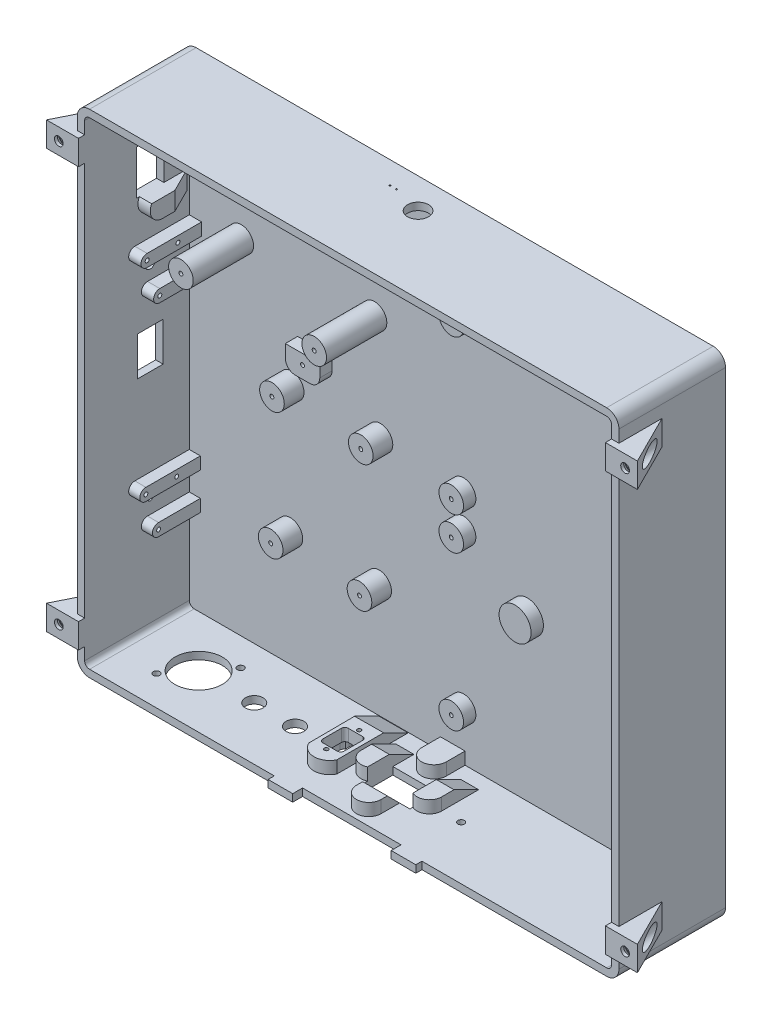
from build123d import *

# Parameters (mm, degrees)
SKETCH2_W                                      = 279.4
SKETCH2_H                                      = 254
BOSS_EXTRUDE1_DEPTH                            = 1
FILLET2_R                                      = 6.35
BOSS_EXTRUDE3_START                            = 57.15
BOSS_EXTRUDE3_DEPTH                            = 57.15
SKETCH7_W                                      = 50.8
SKETCH7_H                                      = 5.08
ROMEX_ENTRY_SLOT_DEPTH                         = 57.15
BOSS_EXTRUDE4_DEPTH                            = 12.7
SKETCH9_R                                      = 3.81
CUT_EXTRUDE2_DEPTH                             = 35.306
MIRROR3_COPY_1_DEPTH                           = 12.7
MIRROR3_COPY_2_SKETCH_R                        = 3.81
MIRROR3_COPY_2_DEPTH                           = 35.306
MIRROR4_COPY_1_DEPTH                           = 12.7
MIRROR4_COPY_2_SKETCH_R                        = 3.81
MIRROR4_COPY_2_DEPTH                           = 35.306
MIRROR4_COPY_4_DEPTH                           = 12.7
MIRROR4_COPY_5_SKETCH_R                        = 3.81
MIRROR4_COPY_5_DEPTH                           = 35.306
MIRROR4_COPY_7_DEPTH                           = 12.7
MIRROR4_COPY_8_SKETCH_R                        = 3.81
MIRROR4_COPY_8_DEPTH                           = 35.306
SKETCH15_W                                     = 12.7
SKETCH15_H                                     = 228.6
CUT_EXTRUDE4_DEPTH                             = 30.226
CUT_EXTRUDE8_REACH                             = 325.779
SKETCH24_R                                     = 2.5019
SKETCH24_R_2                                   = 1.318988248
SKETCH24_W                                     = 13.208
SKETCH24_H                                     = 20.066
SKETCH24_W_2                                   = 14.0462
SKETCH24_H_2                                   = 22.86
CUT_EXTRUDE10_REACH                            = 325.779
SKETCH30_R                                     = 1.27
RIGHT_SIDE_FRONT_STANDOFFS_DEPTH               = 6.35
RIGHT_SIDE_REAR_STANDOFFS_DEPTH                = 5.715
F_3_0_213_DIAMETER_HOLE1_D                     = 2.032
F_3_0_213_DIAMETER_HOLE1_DEPTH                 = 6.35
F_3_0_213_DIAMETER_HOLE1_TIP                   = 0.610474389
F_3_0_213_DIAMETER_HOLE2_D                     = 2.032
F_3_0_213_DIAMETER_HOLE2_DEPTH                 = 6.35
F_3_0_213_DIAMETER_HOLE2_TIP                   = 0.610474389
SKETCH39_R                                     = 8.255
SKETCH39_R_2                                   = 6.35
BOSS_EXTRUDE11_DEPTH                           = 6.35
STANDOFF_HOLES_D                               = 2.032
STANDOFF_HOLES_DEPTH                           = 6.35
STANDOFF_HOLES_TIP                             = 0.610474389
SKETCH49_R                                     = 6.35
MOTHERBOARD_STANDOFFS_DEPTH                    = 10.16
MOTHERBOARD_SCREW_HOLES_D                      = 2.032
MOTHERBOARD_SCREW_HOLES_DEPTH                  = 6.35
MOTHERBOARD_SCREW_HOLES_TIP                    = 0.610474389
BOSS_EXTRUDE13_DEPTH                           = 6.35
SKETCH58_R                                     = 4.572
SKETCH58_R_2                                   = 12.2428
SKETCH58_R_3                                   = 1.7
SKETCH58_R_4                                   = 1.651
CUT_EXTRUDE13_DEPTH                            = 3.81
CUT_EXTRUDE14_REACH                            = 303.866
SKETCH59_R                                     = 5.4356
SKETCH59_R_2                                   = 0.381
SKETCH60_R                                     = 6.35
BOSS_EXTRUDE15_DEPTH                           = 31.115
F_3_0_213_DIAMETER_HOLE6_D                     = 2.032
F_3_0_213_DIAMETER_HOLE6_DEPTH                 = 6.35
F_3_0_213_DIAMETER_HOLE6_TIP                   = 0.610474389
VENT_CUT_DEPTH                                 = 207.727314354
VENT_CUT_DEPTH_BACK                            = 3.175
SKETCH63_W                                     = 3.81
SKETCH63_H                                     = 203.2
USB_CUTOUT_REACH                               = 303.866
USB_STANDOFF_DEPTH                             = 6.35
USB_STANDOFF_SUPPORT_REACH                     = 237.887
SKETCH69_W                                     = 23.368
SKETCH69_H                                     = 14.5542
MOTHERBOARD_POWER_SWITCH_CUTOUT_DEPTH          = 3.81
USB_SCREW_HOLES_D                              = 2.032
USB_SCREW_HOLES_DEPTH                          = 6.35
USB_SCREW_HOLES_TIP                            = 0.610474389
MOTHERBOARD_POWER_SWITCH_STANDOFFS_DEPTH       = 6.35
MOTHERBOARD_POWER_SWITCH_STANDOFF_SUPPOR_DEPTH = 9.09955
MOTHERBOARD_POWER_SWITCH_STANDOFF_SU_2_DEPTH   = 9.09955
REAR_SCREW_HOLES_D                             = 2.794
REAR_SCREW_HOLES_DEPTH                         = 6.35
REAR_SCREW_HOLES_TIP                           = 0.839402285
BOSS_EXTRUDE16_DEPTH                           = 9.35355
BOSS_EXTRUDE17_DEPTH                           = 9.35355
LEFT_SIDE_PSU_SCREW_HOLES_D                    = 2.032
LEFT_SIDE_PSU_SCREW_HOLES_DEPTH                = 6.35
LEFT_SIDE_PSU_SCREW_HOLES_TIP                  = 0.610474389
SLIDE_COVER_STANDOFFS_DEPTH                    = 6.35
F_3_0_213_DIAMETER_HOLE7_D                     = 2.032
F_3_0_213_DIAMETER_HOLE7_DEPTH                 = 6.35
F_3_0_213_DIAMETER_HOLE7_TIP                   = 0.610474389
CUT_EXTRUDE15_DEPTH                            = 12.7


with BuildPart() as part:
    # Sketch2 → Boss-Extrude1 (new body)
    with BuildSketch(Plane.XY):
        Rectangle(SKETCH2_W, SKETCH2_H)
    extrude(amount=BOSS_EXTRUDE1_DEPTH)

    # Fillet2
    fillet2_edges = [part.edges().sort_by_distance(p)[0] for p in [
        (-139.7, 127, 0.5),
        (139.7, 127, 0.5),
        (139.7, -127, 0.5),
        (-139.7, -127, 0.5),
    ]]
    fillet(fillet2_edges, radius=FILLET2_R)

    # Sketch5 → Boss-Extrude3 (add)
    with BuildSketch(Plane.XY.offset(1).offset(BOSS_EXTRUDE3_START)):
        with BuildLine():
            Line((-133.35, -127), (133.35, -127))
            ThreePointArc((133.35, -127), (137.840128061, -125.140128061), (139.7, -120.65))
            Line((139.7, -120.65), (139.7, 120.65))
            ThreePointArc((139.7, 120.65), (137.840128061, 125.140128061), (133.35, 127))
            Line((133.35, 127), (-133.35, 127))
            ThreePointArc((-133.35, 127), (-137.840128061, 125.140128061), (-139.7, 120.65))
            Line((-139.7, 120.65), (-139.7, -120.65))
            ThreePointArc((-139.7, -120.65), (-137.840128061, -125.140128061), (-133.35, -127))
        make_face()
        with BuildLine():
            Line((-133.35, -123.19), (133.35, -123.19))
            ThreePointArc((133.35, -123.19), (135.146051224, -122.446051224), (135.89, -120.65))
            Line((135.89, -120.65), (135.89, 120.65))
            ThreePointArc((135.89, 120.65), (135.146051224, 122.446051224), (133.35, 123.19))
            Line((133.35, 123.19), (-133.35, 123.19))
            ThreePointArc((-133.35, 123.19), (-135.146051224, 122.446051224), (-135.89, 120.65))
            Line((-135.89, 120.65), (-135.89, -120.65))
            ThreePointArc((-135.89, -120.65), (-135.146051224, -122.446051224), (-133.35, -123.19))
        make_face(mode=Mode.SUBTRACT)
    extrude(amount=-BOSS_EXTRUDE3_DEPTH)

    # Sketch7 → Romex Entry Slot (cut)
    with BuildSketch(Plane(origin=(0, -123.19, 0), x_dir=(1, 0, 0), z_dir=(0, 1, 0))):
        with Locations((0, -55.61)):
            Rectangle(SKETCH7_W, SKETCH7_H)
    extrude(amount=-ROMEX_ENTRY_SLOT_DEPTH, mode=Mode.SUBTRACT)

    # Sketch8 → Boss-Extrude4 (add)
    with BuildSketch(Plane(origin=(0, 101.6, 0), x_dir=(1, 0, 0), z_dir=(0, 1, 0))):
        Polygon((-139.7, 0), (-152.4, 0), (-139.7, -25.4), align=None)
    boss_extrude4 = extrude(amount=BOSS_EXTRUDE4_DEPTH)

    # Sketch9 → Cut-Extrude2 (cut)
    with BuildSketch(Plane(origin=(0, 0, 3.81), x_dir=(-1, 0, 0), z_dir=(0, 0, -1))):
        with Locations((146.05, 107.95)):
            Circle(SKETCH9_R)
    cut_extrude2 = extrude(amount=-CUT_EXTRUDE2_DEPTH, mode=Mode.SUBTRACT)

    # Sketch13 → CSK for #8 Flat Head Machine Screw1 (revolve, cut)
    with BuildSketch(Plane(origin=(-146.05, 107.95, 3.81), x_dir=(0, -1, 0), z_dir=(1, 0, 0))):
        Polygon((0, 0), (0, 3.81), (2.2479, 3.81), (2.2479, 2.26450021), (4.2164, 0), align=None)
    csk_for_8_flat_head_machine_screw1 = revolve(axis=Axis((-146.05, 107.95, 10.16), (0, 0, -1)), mode=Mode.SUBTRACT)

    # Mirror2: Boss-Extrude4, Cut-Extrude2, CSK for #8 Flat Head Machine Screw1 across plane
    add(boss_extrude4.mirror(Plane.ZX))
    add(cut_extrude2.mirror(Plane.ZX), mode=Mode.SUBTRACT)
    add(csk_for_8_flat_head_machine_screw1.mirror(Plane.ZX), mode=Mode.SUBTRACT)

    # Mirror3: Boss-Extrude4, Cut-Extrude2, CSK for #8 Flat Head Machine Screw1 across plane
    add(boss_extrude4.mirror(Plane.ZY))
    add(cut_extrude2.mirror(Plane.ZY), mode=Mode.SUBTRACT)
    add(csk_for_8_flat_head_machine_screw1.mirror(Plane.ZY), mode=Mode.SUBTRACT)

    # Mirror3 copy 1 sketch → Mirror3 copy 1 (add)
    with BuildSketch(Plane(origin=(0, -101.6, 0), x_dir=(-1, 0, 0), z_dir=(0, -1, 0))):
        Polygon((-139.7, 0), (-152.4, 0), (-139.7, -25.4), align=None)
    extrude(amount=MIRROR3_COPY_1_DEPTH)

    # Mirror3 copy 2 sketch → Mirror3 copy 2 (cut)
    with BuildSketch(Plane(origin=(0, 0, 3.81), x_dir=(1, 0, 0), z_dir=(0, 0, -1))):
        with Locations((146.05, 107.95)):
            Circle(MIRROR3_COPY_2_SKETCH_R)
    extrude(amount=-MIRROR3_COPY_2_DEPTH, mode=Mode.SUBTRACT)

    # Mirror3 copy 3 sketch → Mirror3 copy 3 (revolve, cut)
    with BuildSketch(Plane(origin=(146.05, -107.95, 3.81), x_dir=(0, 1, 0), z_dir=(-1, 0, 0))):
        Polygon((0, 0), (0, 3.81), (2.2479, 3.81), (2.2479, 2.26450021), (4.2164, 0), align=None)
    revolve(axis=Axis((146.05, -107.95, 10.16), (0, 0, -1)), mode=Mode.SUBTRACT)

    # Mirror4: Boss-Extrude4, Cut-Extrude2, CSK for #8 Flat Head Machine Screw1 across plane
    add(boss_extrude4.mirror(Plane(origin=(0, 0, 29.075), x_dir=(1, 0, 0), z_dir=(0, 0, -1))))
    add(cut_extrude2.mirror(Plane(origin=(0, 0, 29.075), x_dir=(1, 0, 0), z_dir=(0, 0, -1))), mode=Mode.SUBTRACT)
    add(csk_for_8_flat_head_machine_screw1.mirror(Plane(origin=(0, 0, 29.075), x_dir=(1, 0, 0), z_dir=(0, 0, -1))), mode=Mode.SUBTRACT)

    # Mirror4 copy 1 sketch → Mirror4 copy 1 (add)
    with BuildSketch(Plane(origin=(0, -101.6, 58.15), x_dir=(1, 0, 0), z_dir=(0, -1, 0))):
        Polygon((-139.7, 0), (-152.4, 0), (-139.7, -25.4), align=None)
    extrude(amount=MIRROR4_COPY_1_DEPTH)

    # Mirror4 copy 2 sketch → Mirror4 copy 2 (cut)
    with BuildSketch(Plane(origin=(0, 0, 54.34), x_dir=(-1, 0, 0), z_dir=(0, 0, 1))):
        with Locations((146.05, 107.95)):
            Circle(MIRROR4_COPY_2_SKETCH_R)
    extrude(amount=-MIRROR4_COPY_2_DEPTH, mode=Mode.SUBTRACT)

    # Mirror4 copy 3 sketch → Mirror4 copy 3 (revolve, cut)
    with BuildSketch(Plane(origin=(-146.05, -107.95, 54.34), x_dir=(0, 1, 0), z_dir=(1, 0, 0))):
        Polygon((0, 0), (0, 3.81), (2.2479, 3.81), (2.2479, 2.26450021), (4.2164, 0), align=None)
    revolve(axis=Axis((-146.05, -107.95, 47.99), (0, 0, 1)), mode=Mode.SUBTRACT)

    # Mirror4 copy 4 sketch → Mirror4 copy 4 (add)
    with BuildSketch(Plane(origin=(0, 101.6, 58.15), x_dir=(-1, 0, 0), z_dir=(0, 1, 0))):
        Polygon((-139.7, 0), (-152.4, 0), (-139.7, -25.4), align=None)
    extrude(amount=MIRROR4_COPY_4_DEPTH)

    # Mirror4 copy 5 sketch → Mirror4 copy 5 (cut)
    with BuildSketch(Plane.XY.offset(54.34)):
        with Locations((146.05, 107.95)):
            Circle(MIRROR4_COPY_5_SKETCH_R)
    extrude(amount=-MIRROR4_COPY_5_DEPTH, mode=Mode.SUBTRACT)

    # Mirror4 copy 6 sketch → Mirror4 copy 6 (revolve, cut)
    with BuildSketch(Plane(origin=(146.05, 107.95, 54.34), x_dir=(0, -1, 0), z_dir=(-1, 0, 0))):
        Polygon((0, 0), (0, 3.81), (2.2479, 3.81), (2.2479, 2.26450021), (4.2164, 0), align=None)
    revolve(axis=Axis((146.05, 107.95, 47.99), (0, 0, 1)), mode=Mode.SUBTRACT)

    # Mirror4 copy 7 sketch → Mirror4 copy 7 (add)
    with BuildSketch(Plane(origin=(0, -101.6, 58.15), x_dir=(-1, 0, 0), z_dir=(0, -1, 0))):
        Polygon((-139.7, 0), (-152.4, 0), (-139.7, 25.4), align=None)
    extrude(amount=MIRROR4_COPY_7_DEPTH)

    # Mirror4 copy 8 sketch → Mirror4 copy 8 (cut)
    with BuildSketch(Plane.XY.offset(54.34)):
        with Locations((146.05, -107.95)):
            Circle(MIRROR4_COPY_8_SKETCH_R)
    extrude(amount=-MIRROR4_COPY_8_DEPTH, mode=Mode.SUBTRACT)

    # Mirror4 copy 9 sketch → Mirror4 copy 9 (revolve, cut)
    with BuildSketch(Plane(origin=(146.05, -107.95, 54.34), x_dir=(0, 1, 0), z_dir=(-1, 0, 0))):
        Polygon((0, 0), (0, -3.81), (2.2479, -3.81), (2.2479, -2.26450021), (4.2164, 0), align=None)
    revolve(axis=Axis((146.05, -107.95, 47.99), (0, 0, -1)), mode=Mode.SUBTRACT)

    # Sketch15 → Cut-Extrude4 (cut)
    with BuildSketch(Plane(origin=(0, 0, 0), x_dir=(-1, 0, 0), z_dir=(0, 0, -1))):
        with Locations((-146.05, 0)):
            Rectangle(SKETCH15_W, SKETCH15_H)
        with Locations((146.05, 0)):
            Rectangle(SKETCH15_W, SKETCH15_H)
    extrude(amount=-CUT_EXTRUDE4_DEPTH, mode=Mode.SUBTRACT)

    # Sketch24 → Cut-Extrude8 (cut, up to next)
    with BuildSketch(Plane.ZY.offset(139.7), mode=Mode.PRIVATE) as cut_extrude8_sk1:
        with Locations((21.1375, 39.941265276)):
            Circle(SKETCH24_R)
    cut_extrude8_tool1 = extrude(cut_extrude8_sk1.sketch, amount=-CUT_EXTRUDE8_REACH, mode=Mode.PRIVATE) & part.part
    # Sketch24 → Cut-Extrude8 (cut, up to next)
    with BuildSketch(Plane.ZY.offset(139.7), mode=Mode.PRIVATE) as cut_extrude8_sk2:
        with Locations((21.1375, 98.41033486)):
            Circle(SKETCH24_R_2)
    cut_extrude8_tool2 = extrude(cut_extrude8_sk2.sketch, amount=-CUT_EXTRUDE8_REACH, mode=Mode.PRIVATE) & part.part
    # Sketch24 → Cut-Extrude8 (cut, up to next)
    with BuildSketch(Plane.ZY.offset(139.7), mode=Mode.PRIVATE) as cut_extrude8_sk3:
        with Locations((21.1375, 69.54323486)):
            Circle(SKETCH24_R_2)
    cut_extrude8_tool3 = extrude(cut_extrude8_sk3.sketch, amount=-CUT_EXTRUDE8_REACH, mode=Mode.PRIVATE) & part.part
    # Sketch24 → Cut-Extrude8 (cut, up to next)
    with BuildSketch(Plane.ZY.offset(139.7), mode=Mode.PRIVATE) as cut_extrude8_sk4:
        with Locations((21.1375, 1.653505964)):
            Rectangle(SKETCH24_W, SKETCH24_H)
    cut_extrude8_tool4 = extrude(cut_extrude8_sk4.sketch, amount=-CUT_EXTRUDE8_REACH, mode=Mode.PRIVATE) & part.part
    # Sketch24 → Cut-Extrude8 (cut, up to next)
    with BuildSketch(Plane.ZY.offset(139.7), mode=Mode.PRIVATE) as cut_extrude8_sk5:
        with Locations((21.1375, 83.97678486)):
            Rectangle(SKETCH24_W_2, SKETCH24_H_2)
    cut_extrude8_tool5 = extrude(cut_extrude8_sk5.sketch, amount=-CUT_EXTRUDE8_REACH, mode=Mode.PRIVATE) & part.part
    add(cut_extrude8_tool1.solids().sort_by_distance((-139.7, 39.941265, 21.1375))[0], mode=Mode.SUBTRACT)
    add(cut_extrude8_tool2.solids().sort_by_distance((-139.7, 98.410335, 21.1375))[0], mode=Mode.SUBTRACT)
    add(cut_extrude8_tool3.solids().sort_by_distance((-139.7, 69.543235, 21.1375))[0], mode=Mode.SUBTRACT)
    add(cut_extrude8_tool4.solids().sort_by_distance((-139.7, 1.653506, 21.1375))[0], mode=Mode.SUBTRACT)
    add(cut_extrude8_tool5.solids().sort_by_distance((-139.7, 83.976785, 21.1375))[0], mode=Mode.SUBTRACT)

    # Sketch30 → Cut-Extrude10 (cut, up to next)
    with BuildSketch(Plane.ZY.offset(139.7), mode=Mode.PRIVATE) as cut_extrude10_sk1:
        with Locations((21.1375, -64.878547454)):
            Circle(SKETCH30_R)
    cut_extrude10_tool1 = extrude(cut_extrude10_sk1.sketch, amount=-CUT_EXTRUDE10_REACH, mode=Mode.PRIVATE) & part.part
    add(cut_extrude10_tool1.solids().sort_by_distance((-139.7, -64.878547, 21.1375))[0], mode=Mode.SUBTRACT)

    # Sketch27 → Right Side Front Standoffs (add)
    with BuildSketch(Plane(origin=(-135.89, 0, 0), x_dir=(0, 0, -1), z_dir=(1, 0, 0))):
        with BuildLine():
            Line((-29.0864608, 51.565215276), (-1, 51.565215276))
            Line((-1, 51.565215276), (-1, 45.215215276))
            Line((-1, 45.215215276), (-29.0864608, 45.215215276))
            ThreePointArc((-29.0864608, 45.215215276), (-32.2614608, 48.390215276), (-29.0864608, 51.565215276))
        make_face()
        with BuildLine():
            Line((-22.5523108, 32.585065276), (-1, 32.585065276))
            Line((-1, 32.585065276), (-1, 26.235065276))
            Line((-1, 26.235065276), (-22.5523108, 26.235065276))
            ThreePointArc((-22.5523108, 26.235065276), (-25.7273108, 29.410065276), (-22.5523108, 32.585065276))
        make_face()
        with BuildLine():
            Line((-14.7875, 104.76033486), (-14.7875, 95.40678486))
            Line((-14.7875, 95.40678486), (-26.73224641, 95.40678486))
            ThreePointArc((-26.73224641, 95.40678486), (-26.587043215, 101.669932803), (-21.1375, 104.76033486))
            Line((-21.1375, 104.76033486), (-14.7875, 104.76033486))
        make_face()
        with BuildLine():
            Line((-21.1375, 63.19323486), (-14.7875, 63.19323486))
            Line((-14.7875, 63.19323486), (-14.7875, 72.54678486))
            Line((-14.7875, 72.54678486), (-26.73224641, 72.54678486))
            ThreePointArc((-26.73224641, 72.54678486), (-26.587043215, 66.283636917), (-21.1375, 63.19323486))
        make_face()
    extrude(amount=RIGHT_SIDE_FRONT_STANDOFFS_DEPTH)

    # Sketch28 → Right Side Rear Standoffs (add)
    with BuildSketch(Plane(origin=(-135.89, 0, 0), x_dir=(0, 0, -1), z_dir=(1, 0, 0))):
        with BuildLine():
            Line((-29.0864608, -53.254597454), (-1, -53.254597454))
            Line((-1, -53.254597454), (-1, -59.604597454))
            Line((-1, -59.604597454), (-29.0864608, -59.604597454))
            ThreePointArc((-29.0864608, -59.604597454), (-32.2614608, -56.429597454), (-29.0864608, -53.254597454))
        make_face()
        with BuildLine():
            Line((-22.5523108, -72.234747454), (-1, -72.234747454))
            Line((-1, -72.234747454), (-1, -78.584747454))
            Line((-1, -78.584747454), (-22.5523108, -78.584747454))
            ThreePointArc((-22.5523108, -78.584747454), (-25.7273108, -75.409747454), (-22.5523108, -72.234747454))
        make_face()
    extrude(amount=RIGHT_SIDE_REAR_STANDOFFS_DEPTH)

    # #3 (0.213) Diameter Hole1
    with Locations(Plane(origin=(-129.54, 0, 0), x_dir=(0, 0, -1), z_dir=(1, 0, 0))):
        with Locations((-29.0864608, 48.390215276), (-13.18855, 48.390215276), (-22.5523108, 29.410065276)):
            Hole(F_3_0_213_DIAMETER_HOLE1_D / 2, depth=F_3_0_213_DIAMETER_HOLE1_DEPTH)
            with Locations((0, 0, -(F_3_0_213_DIAMETER_HOLE1_DEPTH + F_3_0_213_DIAMETER_HOLE1_TIP / 2))):  # 118° drill point
                Cone(0, F_3_0_213_DIAMETER_HOLE1_D / 2, F_3_0_213_DIAMETER_HOLE1_TIP, mode=Mode.SUBTRACT)

    # #3 (0.213) Diameter Hole2
    with Locations(Plane(origin=(-130.175, 0, 0), x_dir=(0, 0, -1), z_dir=(1, 0, 0))):
        with Locations((-29.0864608, -56.429597454), (-13.18855, -56.429597454), (-22.5523108, -75.409747454)):
            Hole(F_3_0_213_DIAMETER_HOLE2_D / 2, depth=F_3_0_213_DIAMETER_HOLE2_DEPTH)
            with Locations((0, 0, -(F_3_0_213_DIAMETER_HOLE2_DEPTH + F_3_0_213_DIAMETER_HOLE2_TIP / 2))):  # 118° drill point
                Cone(0, F_3_0_213_DIAMETER_HOLE2_D / 2, F_3_0_213_DIAMETER_HOLE2_TIP, mode=Mode.SUBTRACT)

    # Sketch39 → Boss-Extrude11 (add)
    with BuildSketch(Plane.XY.offset(1)):
        with Locations(Location((123.698, -40.639456059, 0), (0, 0, 180))):
            Circle(SKETCH39_R)
        with Locations(Location((38.5191, 112.116669853, 0), (0, 0, 180))):
            Circle(SKETCH39_R)
        with Locations(Location((5.583485881, -98.020620855, 0), (0, 0, 180))):
            Circle(SKETCH39_R_2)
        with Locations(Location((5.583485881, -18.645620855, 0), (0, 0, 180))):
            Circle(SKETCH39_R_2)
        with Locations(Location((5.583485881, -1.500620855, 0), (0, 0, 180))):
            Circle(SKETCH39_R_2)
        with Locations(Location((5.583485881, 77.874379145, 0), (0, 0, 180))):
            Circle(SKETCH39_R_2)
        with Locations(Location((38.5191, -40.639456059, 0), (0, 0, 180))):
            Circle(SKETCH39_R)
        with Locations(Location((123.698, 112.116669853, 0), (0, 0, 180))):
            Circle(SKETCH39_R)
        with BuildLine():
            Line((-80.013490438, 105.820173199), (-62.233490438, 105.820173199))
            Line((-62.233490438, 105.820173199), (-62.233490438, 114.418436715))
            ThreePointArc((-62.233490438, 114.418436715), (-63.72138799, 118.010539163), (-67.313490438, 119.498436715))
            Line((-67.313490438, 119.498436715), (-74.933490438, 119.498436715))
            ThreePointArc((-74.933490438, 119.498436715), (-78.525592887, 118.010539163), (-80.013490438, 114.418436715))
            Line((-80.013490438, 114.418436715), (-80.013490438, 105.820173199))
        make_face()
        with BuildLine():
            Line((-62.233490438, 25.175173199), (-80.013490438, 25.175173199))
            Line((-80.013490438, 25.175173199), (-80.013490438, 18.722402026))
            ThreePointArc((-80.013490438, 18.722402026), (-78.525592887, 15.130299577), (-74.933490438, 13.642402026))
            Line((-74.933490438, 13.642402026), (-67.313490438, 13.642402026))
            ThreePointArc((-67.313490438, 13.642402026), (-63.72138799, 15.130299577), (-62.233490438, 18.722402026))
            Line((-62.233490438, 18.722402026), (-62.233490438, 25.175173199))
        make_face()
    extrude(amount=BOSS_EXTRUDE11_DEPTH)

    # Standoff Holes
    with Locations(Plane.XY.offset(7.35)):
        with Locations((-71.123490438, 20.050115749), (-71.123490438, 113.090722992), (5.583485881, -98.020620855), (5.583485881, -18.645620855), (5.583485881, -1.500620855), (5.583485881, 77.874379145), (123.698, -40.639456059), (38.5191, 112.116669853)):
            Hole(STANDOFF_HOLES_D / 2, depth=STANDOFF_HOLES_DEPTH)
            with Locations((0, 0, -(STANDOFF_HOLES_DEPTH + STANDOFF_HOLES_TIP / 2))):  # 118° drill point
                Cone(0, STANDOFF_HOLES_D / 2, STANDOFF_HOLES_TIP, mode=Mode.SUBTRACT)

    # Sketch49 → Motherboard Standoffs (add)
    with BuildSketch(Plane.XY.offset(1)):
        with Locations(Location((-83.086839482, 1.79886482, 0), (0, 0, 180))):
            Circle(SKETCH49_R)
        with Locations(Location((-37.280139973, 1.339777633, 0), (0, 0, 180))):
            Circle(SKETCH49_R)
        with Locations(Location((-37.939662527, -64.465917493, 0), (0, 0, 180))):
            Circle(SKETCH49_R)
        with Locations(Location((-83.746362036, -64.006830306, 0), (0, 0, 180))):
            Circle(SKETCH49_R)
    extrude(amount=MOTHERBOARD_STANDOFFS_DEPTH)

    # Motherboard Screw Holes
    with Locations(Plane.XY.offset(11.16)):
        with Locations((-83.086839482, 1.79886482), (-37.280139973, 1.339777633), (-37.939662527, -64.465917493), (-83.746362036, -64.006830306)):
            Hole(MOTHERBOARD_SCREW_HOLES_D / 2, depth=MOTHERBOARD_SCREW_HOLES_DEPTH)
            with Locations((0, 0, -(MOTHERBOARD_SCREW_HOLES_DEPTH + MOTHERBOARD_SCREW_HOLES_TIP / 2))):  # 118° drill point
                Cone(0, MOTHERBOARD_SCREW_HOLES_D / 2, MOTHERBOARD_SCREW_HOLES_TIP, mode=Mode.SUBTRACT)

    # Sketch55 → Boss-Extrude13 (add)
    with BuildSketch(Plane.ZY.offset(-135.89)):
        with BuildLine():
            Line((36.66905, 118.947100483), (1, 118.947100483))
            Line((1, 118.947100483), (1, 106.247100483))
            Line((1, 106.247100483), (36.66905, 106.247100483))
            ThreePointArc((36.66905, 106.247100483), (43.01905, 112.597100483), (36.66905, 118.947100483))
        make_face()
        with BuildLine():
            Line((35.3165, -30.112799517), (1, -30.112799517))
            Line((1, -30.112799517), (1, -42.812799517))
            Line((1, -42.812799517), (35.3165, -42.812799517))
            ThreePointArc((35.3165, -42.812799517), (41.6665, -36.462799517), (35.3165, -30.112799517))
        make_face()
    extrude(amount=BOSS_EXTRUDE13_DEPTH)

    # Sketch58 → Cut-Extrude13 (cut)
    with BuildSketch(Plane.XZ.offset(127)):
        with Locations((-54.883181914, 27.4875)):
            Circle(SKETCH58_R)
        with Locations((-75.898929205, 27.4875)):
            Circle(SKETCH58_R)
        with Locations((-104.593225877, 27.4875)):
            Circle(SKETCH58_R_2)
        with Locations((-95.017425877, 15.3971)):
            Circle(SKETCH58_R_3)
        with Locations((-114.169025877, 39.5779)):
            Circle(SKETCH58_R_3)
        with Locations((127.606509889, 27.4875)):
            Circle(SKETCH58_R_4)
        with Locations((30.807109889, 27.4875)):
            Circle(SKETCH58_R_4)
    extrude(amount=-CUT_EXTRUDE13_DEPTH, mode=Mode.SUBTRACT)

    # Sketch59 → Cut-Extrude14 (cut, up to next)
    with BuildSketch(Plane(origin=(0, 127, 0), x_dir=(1, 0, 0), z_dir=(0, 1, 0)), mode=Mode.PRIVATE) as cut_extrude14_sk1:
        with Locations(Location((-3.291977324, -15.605, 0), (0, 0, 180))):
            Circle(SKETCH59_R)
    cut_extrude14_tool1 = extrude(cut_extrude14_sk1.sketch, amount=-CUT_EXTRUDE14_REACH, mode=Mode.PRIVATE) & part.part
    # Sketch59 → Cut-Extrude14 (cut, up to next)
    with BuildSketch(Plane(origin=(0, 127, 0), x_dir=(1, 0, 0), z_dir=(0, 1, 0)), mode=Mode.PRIVATE) as cut_extrude14_sk2:
        with Locations(Location((-21.773536951, -11.580675337, 0), (0, 0, 180))):
            Circle(SKETCH59_R_2)
    cut_extrude14_tool2 = extrude(cut_extrude14_sk2.sketch, amount=-CUT_EXTRUDE14_REACH, mode=Mode.PRIVATE) & part.part
    # Sketch59 → Cut-Extrude14 (cut, up to next)
    with BuildSketch(Plane(origin=(0, 127, 0), x_dir=(1, 0, 0), z_dir=(0, 1, 0)), mode=Mode.PRIVATE) as cut_extrude14_sk3:
        with Locations(Location((-18.471536951, -11.580675337, 0), (0, 0, 180))):
            Circle(SKETCH59_R_2)
    cut_extrude14_tool3 = extrude(cut_extrude14_sk3.sketch, amount=-CUT_EXTRUDE14_REACH, mode=Mode.PRIVATE) & part.part
    add(cut_extrude14_tool1.solids().sort_by_distance((-3.291977, 127, 15.605))[0], mode=Mode.SUBTRACT)
    add(cut_extrude14_tool2.solids().sort_by_distance((-21.773537, 127, 11.580675))[0], mode=Mode.SUBTRACT)
    add(cut_extrude14_tool3.solids().sort_by_distance((-18.471537, 127, 11.580675))[0], mode=Mode.SUBTRACT)

    # Sketch60 → Boss-Extrude15 (add)
    with BuildSketch(Plane.XY.offset(1)):
        with Locations(Location((-40.347044139, 54.24468354, 0), (0, 0, 180))):
            Circle(SKETCH60_R)
        with Locations(Location((-109.092144139, 54.24468354, 0), (0, 0, 180))):
            Circle(SKETCH60_R)
    extrude(amount=BOSS_EXTRUDE15_DEPTH)

    # #3 (0.213) Diameter Hole6
    with Locations(Plane.XY.offset(32.115)):
        with Locations((-40.347044139, 54.24468354), (-109.092144139, 54.24468354)):
            Hole(F_3_0_213_DIAMETER_HOLE6_D / 2, depth=F_3_0_213_DIAMETER_HOLE6_DEPTH)
            with Locations((0, 0, -(F_3_0_213_DIAMETER_HOLE6_DEPTH + F_3_0_213_DIAMETER_HOLE6_TIP / 2))):  # 118° drill point
                Cone(0, F_3_0_213_DIAMETER_HOLE6_D / 2, F_3_0_213_DIAMETER_HOLE6_TIP, mode=Mode.SUBTRACT)

    # Sketch63 → Vent Cut (cut, two sides: drawn at the far end of the back side and taken through both)
    with BuildSketch(Plane.XY.offset(58.15).offset(-VENT_CUT_DEPTH_BACK)):
        with BuildLine():
            ThreePointArc((133.35, -127), (137.840128061, -125.140128061), (139.7, -120.65))
            Line((139.7, -120.65), (139.7, -114.3))
            Line((139.7, -114.3), (135.89, -114.3))
            Line((135.89, -114.3), (135.89, -120.65))
            ThreePointArc((135.89, -120.65), (135.146051224, -122.446051224), (133.35, -123.19))
            Line((133.35, -123.19), (38.1, -123.19))
            Line((38.1, -123.19), (38.1, -127))
            Line((38.1, -127), (133.35, -127))
        make_face()
        with Locations((137.795, 0)):
            Rectangle(SKETCH63_W, SKETCH63_H)
        with BuildLine():
            Line((135.89, 120.65), (135.89, 114.3))
            Line((135.89, 114.3), (139.7, 114.3))
            Line((139.7, 114.3), (139.7, 120.65))
            ThreePointArc((139.7, 120.65), (137.840128061, 125.140128061), (133.35, 127))
            Line((133.35, 127), (-133.35, 127))
            ThreePointArc((-133.35, 127), (-137.840128061, 125.140128061), (-139.7, 120.65))
            Line((-139.7, 120.65), (-139.7, 114.3))
            Line((-139.7, 114.3), (-135.89, 114.3))
            Line((-135.89, 114.3), (-135.89, 120.65))
            ThreePointArc((-135.89, 120.65), (-135.146051224, 122.446051224), (-133.35, 123.19))
            Line((-133.35, 123.19), (133.35, 123.19))
            ThreePointArc((133.35, 123.19), (135.146051224, 122.446051224), (135.89, 120.65))
        make_face()
        with Locations((-137.795, 0)):
            Rectangle(SKETCH63_W, SKETCH63_H)
        with BuildLine():
            Line((-135.89, -120.65), (-135.89, -114.3))
            Line((-135.89, -114.3), (-139.7, -114.3))
            Line((-139.7, -114.3), (-139.7, -120.65))
            ThreePointArc((-139.7, -120.65), (-137.840128061, -125.140128061), (-133.35, -127))
            Line((-133.35, -127), (-38.1, -127))
            Line((-38.1, -127), (-38.1, -123.19))
            Line((-38.1, -123.19), (-133.35, -123.19))
            ThreePointArc((-133.35, -123.19), (-135.146051224, -122.446051224), (-135.89, -120.65))
        make_face()
    extrude(amount=VENT_CUT_DEPTH + VENT_CUT_DEPTH_BACK, mode=Mode.SUBTRACT)

    # Sketch64 → USB Cutout (cut, up to next)
    with BuildSketch(Plane.XZ.offset(127), mode=Mode.PRIVATE) as usb_cutout_sk1:
        with BuildLine():
            Line((-35.546238772, 35.95205), (-35.546238772, 34.217383312))
            ThreePointArc((-35.546238772, 34.217383312), (-36.234491269, 33.338798191), (-36.479688772, 32.25))
            Line((-36.479688772, 32.25), (-36.479688772, 22.725))
            ThreePointArc((-36.479688772, 22.725), (-36.234491269, 21.636201809), (-35.546238772, 20.757616688))
            Line((-35.546238772, 20.757616688), (-35.546238772, 19.02295))
            ThreePointArc((-35.546238772, 19.02295), (-30.263038772, 13.73975), (-24.979838772, 19.02295))
            Line((-24.979838772, 19.02295), (-24.979838772, 20.757616688))
            ThreePointArc((-24.979838772, 20.757616688), (-24.291586276, 21.636201809), (-24.046388772, 22.725))
            Line((-24.046388772, 22.725), (-24.046388772, 32.25))
            ThreePointArc((-24.046388772, 32.25), (-24.291586276, 33.338798191), (-24.979838772, 34.217383312))
            Line((-24.979838772, 34.217383312), (-24.979838772, 35.95205))
            ThreePointArc((-24.979838772, 35.95205), (-30.263038772, 41.23525), (-35.546238772, 35.95205))
        make_face()
    usb_cutout_tool1 = extrude(usb_cutout_sk1.sketch, amount=-USB_CUTOUT_REACH, mode=Mode.PRIVATE) & part.part
    add(usb_cutout_tool1.solids().sort_by_distance((-30.263039, -127, 27.4875))[0], mode=Mode.SUBTRACT)

    # Sketch68 → USB Standoff (add)
    with BuildSketch(Plane(origin=(0, -123.19, 0), x_dir=(1, 0, 0), z_dir=(0, 1, 0))):
        with BuildLine():
            Line((-22.776388772, -1.254), (-22.776388772, -37.992104132))
            ThreePointArc((-22.776388772, -37.992104132), (-30.263038772, -42.50525), (-37.526024643, -37.640329641))
            Line((-37.526024643, -37.640329641), (-37.749688772, -1.254))
            Line((-37.749688772, -1.254), (-22.776388772, -1.254))
        make_face()
        with BuildLine():
            Line((-35.717688772, -22.725), (-35.717688772, -32.25))
            ThreePointArc((-35.717688772, -32.25), (-35.196924629, -33.507235857), (-33.939688772, -34.028))
            Line((-33.939688772, -34.028), (-26.586388772, -34.028))
            ThreePointArc((-26.586388772, -34.028), (-25.329152916, -33.507235857), (-24.808388772, -32.25))
            Line((-24.808388772, -32.25), (-24.808388772, -22.725))
            ThreePointArc((-24.808388772, -22.725), (-25.329152916, -21.467764143), (-26.586388772, -20.947))
            Line((-26.586388772, -20.947), (-33.939688772, -20.947))
            ThreePointArc((-33.939688772, -20.947), (-35.196924629, -21.467764143), (-35.717688772, -22.725))
        make_face(mode=Mode.SUBTRACT)
    extrude(amount=USB_STANDOFF_DEPTH)

    # USB Standoff support: up to this plane
    usb_standoff_support_end = Plane(origin=(-22.776388772, -116.84, 1.254), z_dir=(-1, 0, 0))
    # Sketch98 → USB Standoff support (cut, up to the surface)
    with BuildSketch(Plane(origin=(-37.755970421, 0, 0.232083212), x_dir=(0.006146811354838226, 0, 0.9999811081766335), z_dir=(-0.9999811081766335, 0, 0.006146811354838226)), mode=Mode.PRIVATE) as usb_standoff_support_sk1:
        Polygon((13.721936094, -116.84), (1.021936094, -123.19), (1.021936094, -116.84), align=None)
    usb_standoff_support_tool1 = split(extrude(usb_standoff_support_sk1.sketch, amount=-USB_STANDOFF_SUPPORT_REACH, mode=Mode.PRIVATE), bisect_by=usb_standoff_support_end, keep=Keep.BOTH, mode=Mode.PRIVATE)
    add(usb_standoff_support_tool1.solids().sort_by_distance((-37.723667, -118.956667, 5.487253))[0], mode=Mode.SUBTRACT)

    # Sketch69 → Motherboard Power Switch Cutout (cut)
    with BuildSketch(Plane.XZ.offset(127)):
        with Locations((0, 27.4875)):
            Rectangle(SKETCH69_W, SKETCH69_H)
    extrude(amount=-MOTHERBOARD_POWER_SWITCH_CUTOUT_DEPTH, mode=Mode.SUBTRACT)

    # USB Screw Holes
    with Locations(Plane(origin=(0, -123.19, 0), x_dir=(-1, 0, 0), z_dir=(0, -1, 0))):
        with Locations((30.263038772, -35.95205), (30.263038772, -19.02295)):
            Hole(USB_SCREW_HOLES_D / 2, depth=USB_SCREW_HOLES_DEPTH)
            with Locations((0, 0, -(USB_SCREW_HOLES_DEPTH + USB_SCREW_HOLES_TIP / 2))):  # 118° drill point
                Cone(0, USB_SCREW_HOLES_D / 2, USB_SCREW_HOLES_TIP, mode=Mode.SUBTRACT)

    # Sketch74 → Motherboard Power Switch Standoffs (add)
    with BuildSketch(Plane(origin=(0, -123.19, 0), x_dir=(1, 0, 0), z_dir=(0, 1, 0))):
        with BuildLine():
            ThreePointArc((11.684, -33.211351395), (17.814589596, -32.862541511), (20.78355, -27.4875))
            Line((20.78355, -27.4875), (20.78355, -21.1375))
            Line((20.78355, -21.1375), (11.684, -21.1375))
            Line((11.684, -21.1375), (11.684, -33.211351395))
        make_face()
        with BuildLine():
            Line((-11.684, -33.211351395), (-11.684, -22.040219874))
            Line((-11.684, -22.040219874), (-20.78355, -22.040219874))
            Line((-20.78355, -22.040219874), (-20.78355, -27.4875))
            ThreePointArc((-20.78355, -27.4875), (-17.814589596, -32.862541511), (-11.684, -33.211351395))
        make_face()
    extrude(amount=MOTHERBOARD_POWER_SWITCH_STANDOFFS_DEPTH)

    # Sketch79 → Motherboard Power Switch Standoff Suppor (add)
    with BuildSketch(Plane.ZY.offset(20.78355)):
        Polygon((22.040219874, -116.84), (22.040219874, -123.19), (9.340219874, -123.19), align=None)
    extrude(amount=-MOTHERBOARD_POWER_SWITCH_STANDOFF_SUPPOR_DEPTH)

    # Sketch80 → Motherboard Power Switch Standoff Su 2 (add)
    with BuildSketch(Plane(origin=(20.78355, 0, 0), x_dir=(0, 0, -1), z_dir=(1, 0, 0))):
        Polygon((-21.1375, -116.84), (-21.1375, -123.19), (-8.4375, -123.19), align=None)
    extrude(amount=-MOTHERBOARD_POWER_SWITCH_STANDOFF_SU_2_DEPTH)

    # Rear Screw Holes
    with Locations(Plane(origin=(0, -127, 0), x_dir=(-1, 0, 0), z_dir=(0, -1, 0))):
        with Locations((14.43355, -27.4875), (-14.43355, -27.4875)):
            Hole(REAR_SCREW_HOLES_D / 2, depth=REAR_SCREW_HOLES_DEPTH)
            with Locations((0, 0, -(REAR_SCREW_HOLES_DEPTH + REAR_SCREW_HOLES_TIP / 2))):  # 118° drill point
                Cone(0, REAR_SCREW_HOLES_D / 2, REAR_SCREW_HOLES_TIP, mode=Mode.SUBTRACT)

    # Sketch83 → Boss-Extrude16 (add)
    with BuildSketch(Plane(origin=(0, 104.76033486, 0), x_dir=(1, 0, 0), z_dir=(0, 1, 0))):
        Polygon((-129.54, -14.7875), (-135.89, -14.7875), (-135.89, -2.0875), align=None)
    extrude(amount=-BOSS_EXTRUDE16_DEPTH)

    # Sketch85 → Boss-Extrude17 (add)
    with BuildSketch(Plane.XZ.offset(-63.19323486)):
        Polygon((-129.54, 14.7875), (-135.89, 14.7875), (-135.89, 2.0875), align=None)
    extrude(amount=-BOSS_EXTRUDE17_DEPTH)

    # Left Side PSU Screw Holes
    with Locations(Plane.ZY.offset(-129.54)):
        with Locations((36.66905, 112.533600483), (35.3165, -36.462799517)):
            Hole(LEFT_SIDE_PSU_SCREW_HOLES_D / 2, depth=LEFT_SIDE_PSU_SCREW_HOLES_DEPTH)
            with Locations((0, 0, -(LEFT_SIDE_PSU_SCREW_HOLES_DEPTH + LEFT_SIDE_PSU_SCREW_HOLES_TIP / 2))):  # 118° drill point
                Cone(0, LEFT_SIDE_PSU_SCREW_HOLES_D / 2, LEFT_SIDE_PSU_SCREW_HOLES_TIP, mode=Mode.SUBTRACT)

    # Sketch92 → Slide Cover Standoffs (add)
    with BuildSketch(Plane(origin=(0, -123.19, 0), x_dir=(1, 0, 0), z_dir=(0, 1, 0))):
        with BuildLine():
            Line((6.35, -10.6854), (6.35, -1))
            Line((6.35, -1), (-6.35, -1))
            Line((-6.35, -1), (-6.35, -10.6854))
            ThreePointArc((-6.35, -10.6854), (0, -17.0354), (6.35, -10.6854))
        make_face()
        with BuildLine():
            Line((6.35, -44.2896), (6.35, -34.7646))
            Line((6.35, -34.7646), (-6.35, -34.7646))
            Line((-6.35, -34.7646), (-6.35, -44.2896))
            ThreePointArc((-6.35, -44.2896), (0, -50.6396), (6.35, -44.2896))
        make_face()
    extrude(amount=SLIDE_COVER_STANDOFFS_DEPTH)

    # #3 (0.213) Diameter Hole7
    with Locations(Plane(origin=(0, -127, 0), x_dir=(-1, 0, 0), z_dir=(0, -1, 0))):
        with Locations((0, -44.2896), (0, -10.6854)):
            Hole(F_3_0_213_DIAMETER_HOLE7_D / 2, depth=F_3_0_213_DIAMETER_HOLE7_DEPTH)
            with Locations((0, 0, -(F_3_0_213_DIAMETER_HOLE7_DEPTH + F_3_0_213_DIAMETER_HOLE7_TIP / 2))):  # 118° drill point
                Cone(0, F_3_0_213_DIAMETER_HOLE7_D / 2, F_3_0_213_DIAMETER_HOLE7_TIP, mode=Mode.SUBTRACT)

    # Sketch99 → Cut-Extrude15 (cut)
    with BuildSketch(Plane.ZY.offset(6.35)):
        Polygon((34.7646, -123.19), (41.1146, -116.84), (34.7646, -116.84), align=None)
    extrude(amount=-CUT_EXTRUDE15_DEPTH, mode=Mode.SUBTRACT)


solid = part.part
